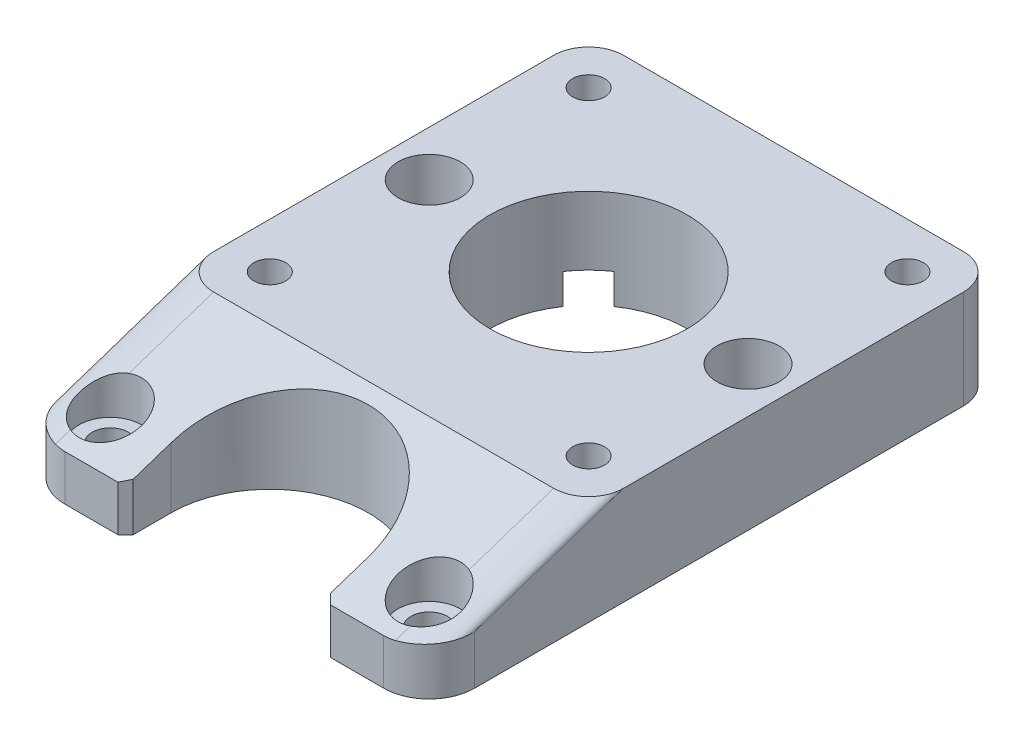
from build123d import *

# Parameters (mm, degrees)
SKETCH_1_R                   = 6.5
EXTRUDE_1_DEPTH              = 6.5
CUT_EXTRUDE_1_DEPTH          = 37.704904304
FILLET_2_R                   = 2.3
SWEEP_START                  = -22.062157242
SWEEP_2_DEPTH                = 13.492384883
CHAMFER_1_SIZE               = 0.5
FILLET_3_R                   = 3
HOLE_WIZARD_M2_1_D           = 2.4
HOLE_WIZARD_M2_1_DEPTH       = 8.5
HOLE_WIZARD_M2_1_CBORE_D     = 4.1
HOLE_WIZARD_M2_1_CBORE_DEPTH = 4.5
HOLE_WIZARD_M2_1_TIP         = 0.721032743
SKETCH_7_R                   = 1.05
CUT_EXTRUDE_2_DEPTH          = 6.5
CUT_EXTRUDE_3_DEPTH          = 4.5
CUT_EXTRUDE_4_DEPTH          = 2
PATTERN_CIRCULAR_1_COUNT     = 4


# Read off the part's stored shape, not the designer's step: ｶｯﾄ - ｽｲｰﾌﾟ2
with BuildPart() as part:
    # ｽｹｯﾁ1 → ﾎﾞｽ - 押し出し1 (new body)
    with BuildSketch(Plane(origin=(0, 0, 0), x_dir=(1, 0, 0), z_dir=(0, 1, 0))):
        with BuildLine():
            Line((-13.5, 13.5), (13.5, 13.5))
            Line((13.5, 13.5), (13.5, -24))
            Line((13.5, -24), (6.5, -24))
            Line((6.5, -24), (6.5, -21))
            ThreePointArc((6.5, -21), (0, -14.5), (-6.5, -21))
            Line((-6.5, -21), (-6.5, -24))
            Line((-6.5, -24), (-13.5, -24))
            Line((-13.5, -24), (-13.5, 13.5))
        make_face()
        with Locations(Location((0, 0, 0), (0, 0, 90))):
            Circle(SKETCH_1_R, mode=Mode.SUBTRACT)
    extrude(amount=EXTRUDE_1_DEPTH)

    # ｽｹｯﾁ2 → ｶｯﾄ - 押し出し1 (cut, through all)
    with BuildSketch(Plane(origin=(13.5, 0, 0), x_dir=(0, 0, -1), z_dir=(1, 0, 0))):
        Polygon((-24, 3), (-24, 6.5), (-13.5, 6.5), align=None)
    extrude(amount=-CUT_EXTRUDE_1_DEPTH, mode=Mode.SUBTRACT)

    # ﾌｨﾚｯﾄ2
    fillet_2_edges = [part.edges().sort_by_distance(p)[0] for p in [
        (-13.5, 3.25, -13.5),
        (13.5, 3.25, -13.5),
    ]]
    fillet(fillet_2_edges, radius=FILLET_2_R)

    # ｶｯﾄ - ｽｲｰﾌﾟ2 outline → ｶｯﾄ - ｽｲｰﾌﾟ2 (cut)
    with BuildSketch(Plane(origin=(0, 0, 0), x_dir=(1, 0, 0), z_dir=(0, 0.3162277660168393, -0.9486832980505134)).offset(SWEEP_START)):
        with BuildLine():
            Line((-13.5, -10.435516279), (-11.2, -10.435516279))
            add(Edge.make_bspline(
                [(-11.2, -10.435516279), (-12.547308807, -10.435516279), (-13.5, -10.134248871), (-13.5, -9.708192417)],
                knots=[0, 0, 0, 0, 1, 1, 1, 1], degree=3, weights=[1, 0.804737854, 0.804737854, 1]))
            Line((-13.5, -9.708192417), (-13.5, -10.435516279))
        make_face()
        with BuildLine():
            add(Edge.make_bspline(
                [(13.5, -9.708192417), (13.5, -10.134248871), (12.547308807, -10.435516279), (11.2, -10.435516279)],
                knots=[0, 0, 0, 0, 1, 1, 1, 1], degree=3, weights=[1, 0.804737854, 0.804737854, 1]))
            Line((11.2, -10.435516279), (13.5, -10.435516279))
            Line((13.5, -10.435516279), (13.5, -9.708192417))
        make_face()
    extrude(amount=SWEEP_2_DEPTH, mode=Mode.SUBTRACT)

    # 面取り1
    chamfer_1_edges = [part.edges().sort_by_distance(p)[0] for p in [
        (6.5, 1.5, 24),
        (-6.5, 1.5, 24),
    ]]
    chamfer(chamfer_1_edges, length=CHAMFER_1_SIZE)

    # ﾌｨﾚｯﾄ3
    # the kernel refuses this fillet: 3 mm, written as the material it takes off along each edge
    with BuildSketch(Plane(origin=(13.5, -7.5, 24), x_dir=(0, 0, -1), z_dir=(0, 1, 0)), Plane(origin=(-13.5, -7.5, 24), x_dir=(1, 0, 0), z_dir=(0, 1, 0))) as fillet_3_piece_1:
        with BuildLine():
            CenterArc((FILLET_3_R, FILLET_3_R), FILLET_3_R, 180, 90)
            Line((0, FILLET_3_R), (0, 0))
            Line((0, 0), (FILLET_3_R, 0))
        make_face()
    extrude(amount=17.233333302, mode=Mode.SUBTRACT)

    # M2 なべ頭ねじ用座ぐり穴1
    with Locations(Plane(origin=(0, 6.5, 0), x_dir=(1, 0, 0), z_dir=(0, 1, 0))):
        with Locations((-10.5, 0), (10.5, 0), (10.5, -21), (-10.5, -21)):
            CounterBoreHole(HOLE_WIZARD_M2_1_D / 2, HOLE_WIZARD_M2_1_CBORE_D / 2, HOLE_WIZARD_M2_1_CBORE_DEPTH, depth=HOLE_WIZARD_M2_1_DEPTH)
            with Locations((0, 0, -(HOLE_WIZARD_M2_1_DEPTH + HOLE_WIZARD_M2_1_TIP / 2))):  # 118° drill point
                Cone(0, HOLE_WIZARD_M2_1_D / 2, HOLE_WIZARD_M2_1_TIP, mode=Mode.SUBTRACT)

    # ｽｹｯﾁ7 → ｶｯﾄ - 押し出し2 (cut)
    with BuildSketch(Plane(origin=(0, 6.5, 0), x_dir=(1, 0, 0), z_dir=(0, 1, 0))):
        with Locations(Location((-10.5, 10.5, 0), (0, 0, 270))):
            Circle(SKETCH_7_R)
        with Locations(Location((10.5, 10.5, 0), (0, 0, 270))):
            Circle(SKETCH_7_R)
        with Locations(Location((-10.5, -10.5, 0), (0, 0, 270))):
            Circle(SKETCH_7_R)
        with Locations(Location((10.5, -10.5, 0), (0, 0, 270))):
            Circle(SKETCH_7_R)
    extrude(amount=-CUT_EXTRUDE_2_DEPTH, mode=Mode.SUBTRACT)

    # ｽｹｯﾁ8 → ｶｯﾄ - 押し出し3 (cut)
    with BuildSketch(Plane.XZ):
        Polygon((-8.213522103, 9.887340094), (-8.826182009, 12.173817991), (-11.112659906, 12.786477897), (-12.786477897, 11.112659906), (-12.173817991, 8.826182009), (-9.887340094, 8.213522103), align=None)
    cut_extrude_3 = extrude(amount=-CUT_EXTRUDE_3_DEPTH, mode=Mode.SUBTRACT)

    # ｽｹｯﾁ9 → ｶｯﾄ - 押し出し4 (cut)
    with BuildSketch(Plane.XZ):
        Polygon((-9.887340094, 8.213522103), (-4.230485845, 2.556667854), (-2.556667854, 4.230485845), (-8.213522103, 9.887340094), align=None)
    cut_extrude_4 = extrude(amount=-CUT_EXTRUDE_4_DEPTH, mode=Mode.SUBTRACT)

    # 円形ﾊﾟﾀｰﾝ1: ｶｯﾄ - 押し出し3, ｶｯﾄ - 押し出し4 ×4 about axis
    pattern_circular_1_axis = Axis((0, 0, 0), (0, 1, 0))
    add([cut_extrude_3.rotate(pattern_circular_1_axis, i * 360 / PATTERN_CIRCULAR_1_COUNT) for i in range(1, PATTERN_CIRCULAR_1_COUNT)], mode=Mode.SUBTRACT)
    add([cut_extrude_4.rotate(pattern_circular_1_axis, i * 360 / PATTERN_CIRCULAR_1_COUNT) for i in range(1, PATTERN_CIRCULAR_1_COUNT)], mode=Mode.SUBTRACT)


solid = part.part
